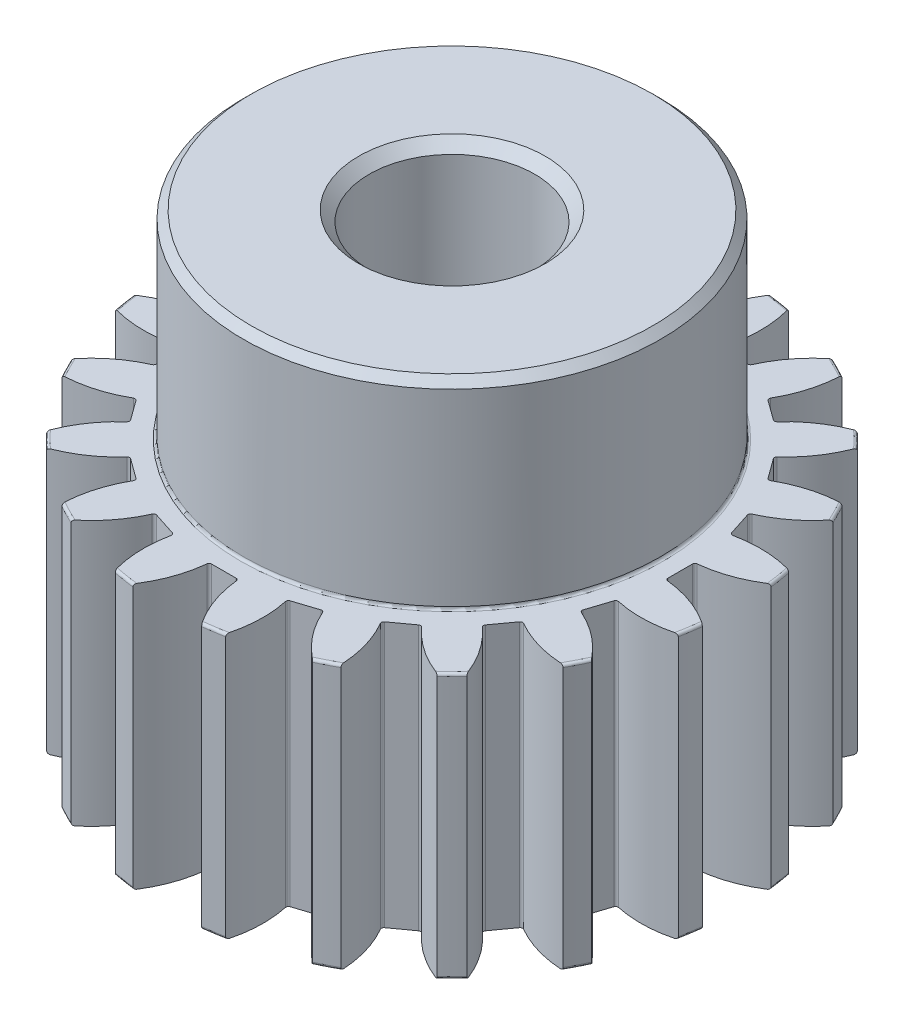
from build123d import *

# Parameters (mm, degrees)
SKETCH1_R           = 4.375
SKETCH1_R_2         = 1.5875
BOSS_EXTRUDE1_DEPTH = 5.08
BOSS_EXTRUDE2_START = -5.08
SKETCH2_R           = 5.5
SKETCH2_R_2         = 4.375
BOSS_EXTRUDE2_DEPTH = 5.08
CUT_EXTRUDE2_REACH  = 11.29
CIRPATTERN1_COUNT   = 20
FILLET1_R           = 0.05
SKETCH4_R           = 4
SKETCH4_R_2         = 1.5875
BOSS_EXTRUDE3_DEPTH = 3.81
CHAMFER1_SIZE       = 0.15
FILLET2_R           = 0.05
CHAMFER2_SIZE       = 0.2
FILLET3_R           = 0.05


# Read off the part's stored shape, not the designer's step: CirPattern5
with BuildPart() as part:
    # Sketch1 → Boss-Extrude1 (new body)
    with BuildSketch(Plane(origin=(0, 0, 0), x_dir=(1, 0, 0), z_dir=(0, 1, 0))):
        with Locations(Location((0, 0, 0), (0, 0, 270))):
            Circle(SKETCH1_R)
        with Locations(Location((0, 0, 0), (0, 0, 270))):
            Circle(SKETCH1_R_2, mode=Mode.SUBTRACT)
    extrude(amount=BOSS_EXTRUDE1_DEPTH)

    # Sketch2 → Boss-Extrude2 (add)
    with BuildSketch(Plane(origin=(0, 5.08, 0), x_dir=(1, 0, 0), z_dir=(0, 1, 0)).offset(BOSS_EXTRUDE2_START)):
        with Locations(Location((0, 0, 0), (0, 0, 270))):
            Circle(SKETCH2_R)
        Circle(SKETCH2_R_2, mode=Mode.SUBTRACT)
    extrude(amount=BOSS_EXTRUDE2_DEPTH)

    # Sketch3 → Cut-Extrude2 (cut, up to next)
    with BuildSketch(Plane(origin=(0, 5.08, 0), x_dir=(1, 0, 0), z_dir=(0, 1, 0)), mode=Mode.PRIVATE) as cut_extrude2_sk1:
        with BuildLine():
            Line((0.6885, 5.5), (-0.6885, 5.5))
            ThreePointArc((-0.6885, 5.5), (-0.408575444, 4.964805838), (-0.2785, 4.375))
            Line((-0.2785, 4.375), (0.2785, 4.375))
            ThreePointArc((0.2785, 4.375), (0.408575444, 4.964805838), (0.6885, 5.5))
        make_face()
    cut_extrude2_tool1 = extrude(cut_extrude2_sk1.sketch, amount=-CUT_EXTRUDE2_REACH, mode=Mode.PRIVATE) & part.part
    cut_extrude2 = cut_extrude2_tool1.solids().sort_by_distance((0, 5.08, -5.026122))[0]
    add(cut_extrude2, mode=Mode.SUBTRACT)

    # CirPattern1: Cut-Extrude2 ×20 about axis
    cirpattern1_axis = Axis((0, 0, 0), (0, 1, 0))
    for i in range(1, CIRPATTERN1_COUNT):
        add(cut_extrude2.rotate(cirpattern1_axis, i * 360 / CIRPATTERN1_COUNT), mode=Mode.SUBTRACT)

    # Fillet1
    fillet1_edges = [part.edges().sort_by_distance(p)[0] for p in [
        (-3.375751158, 2.54, -2.796871712),
        (-3.703147543, 2.54, -2.346249246),
        (-2.346249246, 2.54, -3.703147543),
        (-2.796871712, 2.54, -3.375751158),
        (-4.074811026, 2.54, -1.61681859),
        (-4.246933492, 2.54, -1.087080111),
        (-4.375, 2.54, -0.2785),
        (-4.375, 2.54, 0.2785),
        (-1.61681859, 2.54, 4.074811026),
        (-1.087080111, 2.54, 4.246933492),
        (-2.796871712, 2.54, 3.375751158),
        (-2.346249246, 2.54, 3.703147543),
        (-3.703147543, 2.54, 2.346249246),
        (-3.375751158, 2.54, 2.796871712),
        (-4.246933492, 2.54, 1.087080111),
        (-4.074811026, 2.54, 1.61681859),
        (-0.2785, 2.54, 4.375),
        (0.2785, 2.54, 4.375),
        (1.087080111, 2.54, 4.246933492),
        (1.61681859, 2.54, 4.074811026),
        (3.375751158, 2.54, 2.796871712),
        (3.703147543, 2.54, 2.346249246),
        (2.346249246, 2.54, 3.703147543),
        (2.796871712, 2.54, 3.375751158),
        (4.074811026, 2.54, 1.61681859),
        (4.246933492, 2.54, 1.087080111),
        (4.375, 2.54, 0.2785),
        (4.375, 2.54, -0.2785),
        (4.246933492, 2.54, -1.087080111),
        (4.074811026, 2.54, -1.61681859),
        (3.703147543, 2.54, -2.346249246),
        (3.375751158, 2.54, -2.796871712),
        (2.796871712, 2.54, -3.375751158),
        (2.346249246, 2.54, -3.703147543),
        (1.61681859, 2.54, -4.074811026),
        (1.087080111, 2.54, -4.246933492),
        (0.2785, 2.54, -4.375),
        (-1.087080111, 2.54, -4.246933492),
        (-1.61681859, 2.54, -4.074811026),
        (-0.2785, 2.54, -4.375),
    ]]
    fillet(fillet1_edges, radius=FILLET1_R)

    # Sketch4 → Boss-Extrude3 (add)
    with BuildSketch(Plane(origin=(0, 5.08, 0), x_dir=(1, 0, 0), z_dir=(0, 1, 0))):
        with Locations(Location((0, 0, 0), (0, 0, 90))):
            Circle(SKETCH4_R)
        with Locations(Location((0, 0, 0), (0, 0, 270))):
            Circle(SKETCH4_R_2, mode=Mode.SUBTRACT)
    extrude(amount=BOSS_EXTRUDE3_DEPTH)

    # Chamfer1
    chamfer1_edges = [part.edges().sort_by_distance(p)[0] for p in [
        (0, 8.89, 4),
    ]]
    chamfer(chamfer1_edges, length=CHAMFER1_SIZE)

    # Fillet2
    fillet2_edges = [part.edges().sort_by_distance(p)[0] for p in [
        (0, 5.08, 4),
    ]]
    fillet(fillet2_edges, radius=FILLET2_R)

    # Chamfer2
    chamfer2_edges = [part.edges().sort_by_distance(p)[0] for p in [
        (0, 8.89, -1.5875),
    ]]
    chamfer(chamfer2_edges, length=CHAMFER2_SIZE)

    # Fillet3
    fillet3_edges = [part.edges().sort_by_distance(p)[0] for p in [
        (5.432285873, 0, 0.860389558),
        (5.432285873, 5.08, 0.860389558),
    ]]
    fillet(fillet3_edges, radius=FILLET3_R)

    # CirPattern5 outline → CirPattern5 (revolve, cut)
    with BuildSketch(Plane.XY):
        with BuildLine():
            ThreePointArc((5.5, 0.05), (5.485355339, 0.014644661), (5.45, 0))
            Line((5.45, 0), (5.5, 0))
            Line((5.5, 0), (5.5, 0.05))
        make_face()
        with BuildLine():
            ThreePointArc((5.45, 5.08), (5.485355339, 5.065355339), (5.5, 5.03))
            Line((5.5, 5.03), (5.5, 5.08))
            Line((5.5, 5.08), (5.45, 5.08))
        make_face()
    revolve(axis=Axis((0, 0, 0), (0, 1, 0)), mode=Mode.SUBTRACT)


solid = part.part
